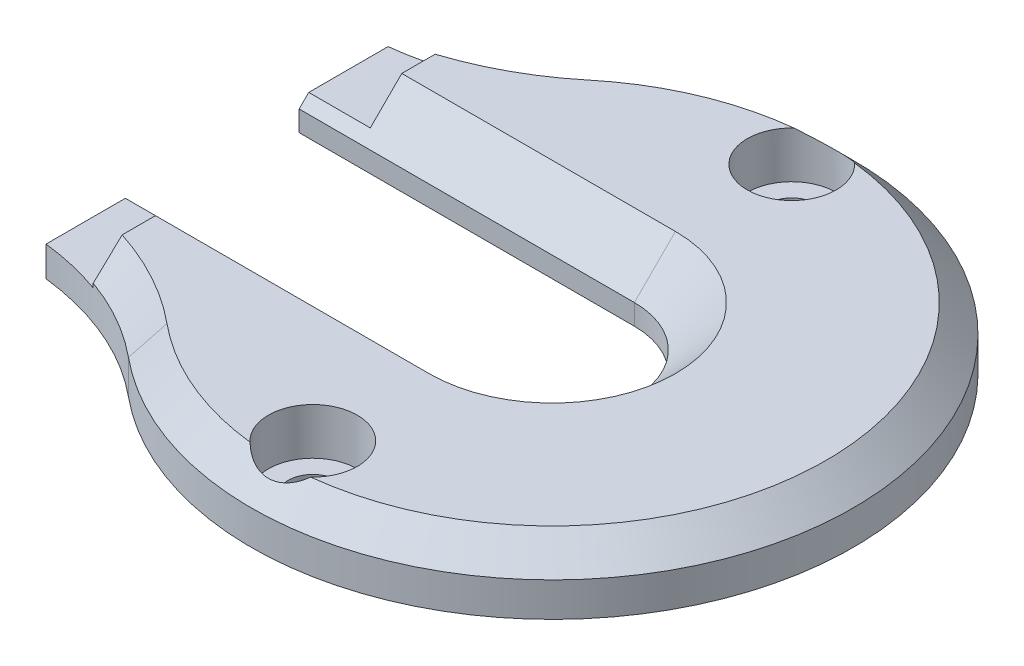
from build123d import *

# Parameters (mm, degrees)
BOSS_EXTRUDE1_DEPTH                                 = 4.5
CUT_EXTRUDE1_DEPTH                                  = 43.552908244
CUT_EXTRUDE1_DEPTH_BACK                             = 43.552908244
SKETCH2_W                                           = 4.5
SKETCH2_H                                           = 2.3
CUT_EXTRUDE2_DEPTH                                  = 34.234018716
CUT_EXTRUDE2_DEPTH_BACK                             = 34.234018716
CBORE_FOR_M3_HEX_SOCKET_HEAD_CAP_SCREW1_D           = 3.6
CBORE_FOR_M3_HEX_SOCKET_HEAD_CAP_SCREW1_CBORE_D     = 6.5
CBORE_FOR_M3_HEX_SOCKET_HEAD_CAP_SCREW1_CBORE_DEPTH = 3.4
FILLET2_DEPTH                                       = 4.5
FILLET2_2_DEPTH                                     = 2.2
CHAMFER1_SIZE                                       = 3
CHAMFER2_SIZE                                       = 2


with BuildPart() as part:
    # Sketch1 → Boss-Extrude1 (new body)
    with BuildSketch(Plane(origin=(0, 0, 0), x_dir=(1, 0, 0), z_dir=(0, 1, 0))):
        with BuildLine():
            Line((-18.10386699, 12.5), (-24.5, 12.5))
            Line((-24.5, 12.5), (-24.5, -12.5))
            Line((-24.5, -12.5), (-18.10386699, -12.5))
            ThreePointArc((-18.10386699, -12.5), (22, 0), (-18.10386699, 12.5))
        make_face()
    extrude(amount=BOSS_EXTRUDE1_DEPTH)

    # Sketch2 → Cut-Extrude1 (cut, two sides: drawn at the far end of the back side and taken through both)
    with BuildSketch(Plane.XY.offset(12.5).offset(-CUT_EXTRUDE1_DEPTH_BACK)):
        with Locations((-22.25, 3.35)):
            Rectangle(SKETCH2_W, SKETCH2_H)
    extrude(amount=CUT_EXTRUDE1_DEPTH + CUT_EXTRUDE1_DEPTH_BACK, mode=Mode.SUBTRACT)

    # Sketch3 → Cut-Extrude2 (cut, two sides: drawn at the far end of the back side and taken through both)
    with BuildSketch(Plane(origin=(0, 4.5, 0), x_dir=(1, 0, 0), z_dir=(0, 1, 0)).offset(-CUT_EXTRUDE2_DEPTH_BACK)):
        with BuildLine():
            Line((0, 6), (-24.5, 6))
            Line((-24.5, 6), (-24.5, -6))
            Line((-24.5, -6), (0, -6))
            ThreePointArc((0, -6), (6, 0), (0, 6))
        make_face()
    extrude(amount=CUT_EXTRUDE2_DEPTH + CUT_EXTRUDE2_DEPTH_BACK, mode=Mode.SUBTRACT)

    # CBORE for M3 Hex Socket Head Cap Screw1 (through all)
    with Locations(Plane(origin=(0, 4.5, 0), x_dir=(1, 0, 0), z_dir=(0, 1, 0))):
        with Locations((0, -17.5), (0, 17.5)):
            CounterBoreHole(CBORE_FOR_M3_HEX_SOCKET_HEAD_CAP_SCREW1_D / 2, CBORE_FOR_M3_HEX_SOCKET_HEAD_CAP_SCREW1_CBORE_D / 2, CBORE_FOR_M3_HEX_SOCKET_HEAD_CAP_SCREW1_CBORE_DEPTH)

    # Fillet2: read off the stored shape, not the designer's step
    # Fillet2 outline → Fillet2 (add)
    with BuildSketch(Plane(origin=(0, 0, 0), x_dir=(1, 0, 0), z_dir=(0, 1, 0))):
        with BuildLine():
            Line((-18.10386699, -12.5), (-20, -12.5))
            Line((-20, -12.5), (-20, -13.548778219))
            ThreePointArc((-20, -13.548778219), (-16.860589429, -14.993334166), (-14.016717362, -16.956757779))
            ThreePointArc((-14.016717362, -16.956757779), (-16.214149909, -14.869476882), (-18.10386699, -12.5))
        make_face()
        with BuildLine():
            ThreePointArc((-18.10386699, 12.5), (-16.214149909, 14.869476882), (-14.016717362, 16.956757779))
            ThreePointArc((-14.016717362, 16.956757779), (-16.860589429, 14.993334166), (-20, 13.548778219))
            Line((-20, 13.548778219), (-20, 12.5))
            Line((-20, 12.5), (-18.10386699, 12.5))
        make_face()
    extrude(amount=FILLET2_DEPTH)

    # Fillet2 2 outline → Fillet2 2 (add)
    with BuildSketch(Plane(origin=(0, 0, 0), x_dir=(1, 0, 0), z_dir=(0, 1, 0))):
        with BuildLine():
            Line((-20, -13.548778219), (-20, -12.5))
            Line((-20, -12.5), (-24.5, -12.5))
            ThreePointArc((-24.5, -12.5), (-22.219610886, -12.893998326), (-20, -13.548778219))
        make_face()
        with BuildLine():
            Line((-20, 12.5), (-20, 13.548778219))
            ThreePointArc((-20, 13.548778219), (-22.219610886, 12.893998326), (-24.5, 12.5))
            Line((-24.5, 12.5), (-20, 12.5))
        make_face()
    extrude(amount=FILLET2_2_DEPTH)

    # Chamfer1
    chamfer1_edges = [part.edges().sort_by_distance(p)[0] for p in [
        (-10, 4.5, 6),
        (-10, 4.5, -6),
        (6, 4.5, 0),
    ]]
    chamfer(chamfer1_edges, length=CHAMFER1_SIZE)

    # Chamfer2
    # the kernel refuses this chamfer: 2 mm, written as the material it takes off along each edge
    with BuildSketch(Plane(origin=(0, 4.5, 0), x_dir=(-0.6371235164664789, 0, 0.7707617172417092), z_dir=(-0.7707617172417092, 0, -0.6371235164664789))) as chamfer2_piece_1:
        Polygon((22 - CHAMFER2_SIZE, 0), (22, -CHAMFER2_SIZE), (22, 0), align=None)
    revolve(axis=Axis((0, 4.5, 0), (0, 1, 0)), revolution_arc=259.155320495, mode=Mode.SUBTRACT)
    with BuildSketch(Plane(origin=(-26.75918769, 4.5, -32.371992129), x_dir=(0.6371235163113105, 0, 0.7707617173699738), z_dir=(0.7707617173699738, 0, -0.6371235163113105))) as chamfer2_piece_2:
        Polygon((20.000000004, CHAMFER2_SIZE), (20.000000004 + CHAMFER2_SIZE, 0), (20.000000004, 0), align=None)
    revolve(axis=Axis((-26.75918769, 4.5, -32.371992129), (0, -1, 0)), revolution_arc=34.56000809, mode=Mode.SUBTRACT)
    with BuildSketch(Plane(origin=(-26.75918769, 4.5, 32.371992129), x_dir=(0.08746265429711, 0, -0.9961677991700516), z_dir=(-0.9961677991700516, 0, -0.08746265429711))) as chamfer2_piece_3:
        Polygon((20.000000004 + CHAMFER2_SIZE, 0), (20.000000004, CHAMFER2_SIZE), (20.000000004, 0), align=None)
    revolve(axis=Axis((-26.75918769, 4.5, 32.371992129), (0, -1, 0)), revolution_arc=34.56000809, mode=Mode.SUBTRACT)


solid = part.part
